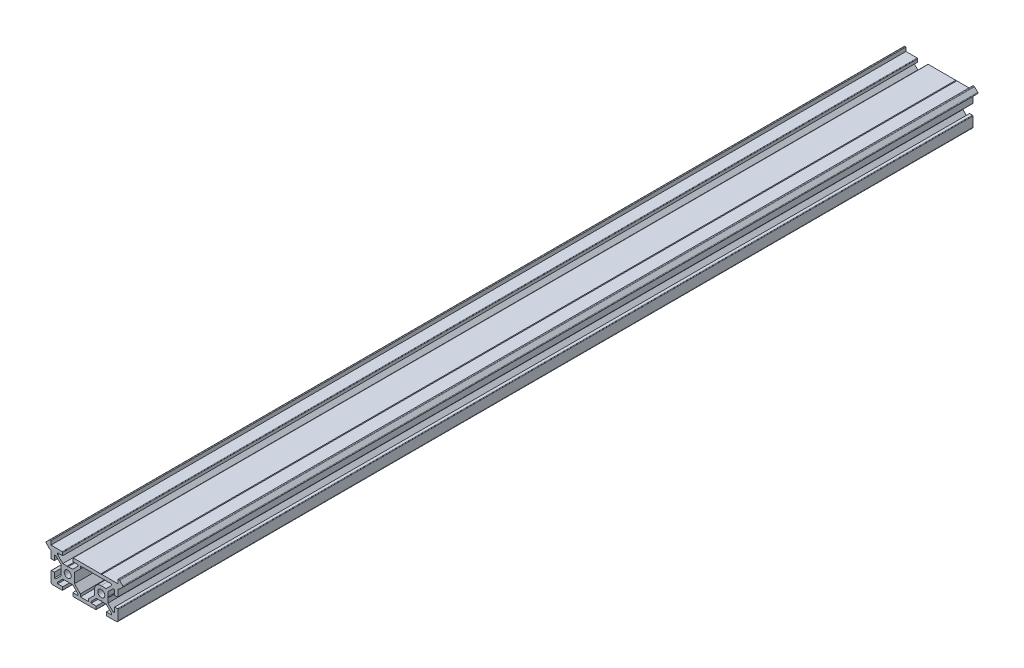
from build123d import *

# Parameters (mm, degrees)
MODEL_R             = 2.100000001
BOSS_EXTRUDE1_DEPTH = 510


with BuildPart() as part:
    # Model → Boss-Extrude1 (new body)
    with BuildSketch(Plane.XY):
        with BuildLine():
            Line((28.771485975, 48.105572105), (30.646485975, 49.980572105))
            ThreePointArc((30.646485975, 49.980572105), (30.808697649, 50.08895848), (31.000039365, 50.127018713))
            Line((31.000039365, 50.127018713), (31.592932584, 50.127018713))
            Line((31.592932584, 50.127018713), (31.592932584, 47.752018713))
            Line((31.592932584, 47.752018713), (38.292932585, 47.752018713))
            ThreePointArc((38.292932585, 47.752018713), (38.505064619, 47.664150748), (38.592932584, 47.452018714))
            Line((38.592932584, 47.452018714), (38.592932584, 45.752018713))
            Line((38.592932584, 45.752018713), (35.592932585, 45.752018713))
            Line((35.592932585, 45.752018713), (35.592932585, 44.812678885))
            Line((35.592932585, 44.812678885), (38.653592756, 41.752018713))
            Line((38.653592756, 41.752018713), (41.292932583, 41.752018713))
            Line((41.292932583, 41.752018713), (41.592932584, 41.452018713))
            Line((41.592932584, 41.452018713), (41.892932586, 41.752018714))
            Line((41.892932586, 41.752018714), (44.532272412, 41.752018714))
            Line((44.532272412, 41.752018714), (47.592932584, 44.812678886))
            Line((47.592932584, 44.812678886), (47.592932584, 45.752018714))
            Line((47.592932584, 45.752018714), (44.592932584, 45.752018714))
            Line((44.592932584, 45.752018714), (44.592932584, 47.452018715))
            ThreePointArc((44.592932584, 47.452018715), (44.68080055, 47.664150749), (44.892932584, 47.752018715))
            Line((44.892932584, 47.752018715), (61.292932583, 47.752018715))
            Line((61.292932583, 47.752018715), (61.592932582, 47.452018715))
            Line((61.592932582, 47.452018715), (61.892932583, 47.752018716))
            Line((61.892932583, 47.752018716), (71.592932583, 47.752018716))
            Line((71.592932583, 47.752018716), (71.592932583, 50.127018711))
            Line((71.592932583, 50.127018711), (72.185825802, 50.127018711))
            ThreePointArc((72.185825802, 50.127018711), (72.377167518, 50.088958477), (72.539379192, 49.980572102))
            Line((72.539379192, 49.980572102), (74.414379192, 48.105572102))
            ThreePointArc((74.414379192, 48.105572102), (74.560825801, 47.752018712), (74.414379192, 47.398465322))
            Line((74.414379192, 47.398465322), (72.539379192, 45.523465322))
            ThreePointArc((72.539379192, 45.523465322), (72.377167518, 45.415078947), (72.185825802, 45.377018714))
            Line((72.185825802, 45.377018714), (72.092932582, 45.377018714))
            ThreePointArc((72.092932582, 45.377018714), (71.739379192, 45.230572103), (71.592932583, 44.877018713))
            Line((71.592932583, 44.877018713), (71.592932583, 41.052018712))
            ThreePointArc((71.592932583, 41.052018712), (71.505064617, 40.839886678), (71.292932581, 40.752018713))
            Line((71.292932581, 40.752018713), (69.592932583, 40.752018713))
            Line((69.592932583, 40.752018713), (69.592932583, 43.752018712))
            Line((69.592932583, 43.752018712), (68.653592755, 43.752018712))
            Line((68.653592755, 43.752018712), (65.592932583, 40.691358541))
            Line((65.592932583, 40.691358541), (65.592932583, 38.052018712))
            Line((65.592932583, 38.052018712), (65.292932584, 37.752018712))
            Line((65.292932584, 37.752018712), (65.592932583, 37.452018713))
            Line((65.592932583, 37.452018713), (65.592932583, 34.812678884))
            Line((65.592932583, 34.812678884), (68.653592755, 31.752018712))
            Line((68.653592755, 31.752018712), (69.592932583, 31.752018712))
            Line((69.592932583, 31.752018712), (69.592932583, 34.752018711))
            Line((69.592932583, 34.752018711), (71.292932581, 34.752018711))
            ThreePointArc((71.292932581, 34.752018711), (71.505064617, 34.664150747), (71.592932583, 34.452018712))
            Line((71.592932583, 34.452018712), (71.592932583, 28.75201871))
            ThreePointArc((71.592932583, 28.75201871), (71.300039364, 28.044911929), (70.592932582, 27.752018711))
            Line((70.592932582, 27.752018711), (64.892932582, 27.752018711))
            ThreePointArc((64.892932582, 27.752018711), (64.680800548, 27.839886676), (64.592932583, 28.05201871))
            Line((64.592932583, 28.05201871), (64.592932583, 29.752018711))
            Line((64.592932583, 29.752018711), (67.592932582, 29.752018711))
            Line((67.592932582, 29.752018711), (67.592932582, 30.69135854))
            Line((67.592932582, 30.69135854), (64.532272411, 33.752018711))
            Line((64.532272411, 33.752018711), (61.892932584, 33.752018711))
            Line((61.892932584, 33.752018711), (61.592932582, 34.052018713))
            Line((61.592932582, 34.052018713), (61.292932582, 33.752018712))
            Line((61.292932582, 33.752018712), (58.653592755, 33.752018712))
            Line((58.653592755, 33.752018712), (55.592932583, 30.691358541))
            Line((55.592932583, 30.691358541), (55.592932583, 29.752018713))
            Line((55.592932583, 29.752018713), (58.592932583, 29.752018713))
            Line((58.592932583, 29.752018713), (58.592932583, 28.052018712))
            ThreePointArc((58.592932583, 28.052018712), (58.505064617, 27.839886678), (58.292932583, 27.752018712))
            Line((58.292932583, 27.752018712), (44.892932584, 27.752018712))
            ThreePointArc((44.892932584, 27.752018712), (44.68080055, 27.839886678), (44.592932584, 28.052018712))
            Line((44.592932584, 28.052018712), (44.592932584, 29.752018713))
            Line((44.592932584, 29.752018713), (47.592932584, 29.752018713))
            Line((47.592932584, 29.752018713), (47.592932584, 30.691358541))
            Line((47.592932584, 30.691358541), (44.532272412, 33.752018712))
            Line((44.532272412, 33.752018712), (41.892932586, 33.752018712))
            Line((41.892932586, 33.752018712), (41.592932584, 34.052018714))
            Line((41.592932584, 34.052018714), (41.292932583, 33.752018714))
            Line((41.292932583, 33.752018714), (38.653592756, 33.752018714))
            Line((38.653592756, 33.752018714), (35.592932585, 30.691358542))
            Line((35.592932585, 30.691358542), (35.592932585, 29.752018714))
            Line((35.592932585, 29.752018714), (38.592932584, 29.752018714))
            Line((38.592932584, 29.752018714), (38.592932584, 28.052018713))
            ThreePointArc((38.592932584, 28.052018713), (38.505064619, 27.839886679), (38.292932585, 27.752018714))
            Line((38.292932585, 27.752018714), (32.592932585, 27.752018714))
            ThreePointArc((32.592932585, 27.752018714), (31.885825803, 28.044911931), (31.592932584, 28.752018713))
            Line((31.592932584, 28.752018713), (31.592932584, 34.452018715))
            ThreePointArc((31.592932584, 34.452018715), (31.68080055, 34.664150748), (31.892932583, 34.752018714))
            Line((31.892932583, 34.752018714), (33.592932584, 34.752018714))
            Line((33.592932584, 34.752018714), (33.592932584, 31.752018715))
            Line((33.592932584, 31.752018715), (34.532272412, 31.752018715))
            Line((34.532272412, 31.752018715), (37.592932584, 34.812678886))
            Line((37.592932584, 34.812678886), (37.592932584, 37.452018715))
            Line((37.592932584, 37.452018715), (37.892932583, 37.752018715))
            Line((37.892932583, 37.752018715), (37.592932584, 38.052018714))
            Line((37.592932584, 38.052018714), (37.592932584, 40.691358543))
            Line((37.592932584, 40.691358543), (34.532272412, 43.752018715))
            Line((34.532272412, 43.752018715), (33.592932584, 43.752018715))
            Line((33.592932584, 43.752018715), (33.592932584, 40.752018716))
            Line((33.592932584, 40.752018716), (31.892932586, 40.752018716))
            ThreePointArc((31.892932586, 40.752018716), (31.68080055, 40.83988668), (31.592932584, 41.052018715))
            Line((31.592932584, 41.052018715), (31.592932584, 44.877018715))
            ThreePointArc((31.592932584, 44.877018715), (31.446485975, 45.230572106), (31.092932585, 45.377018716))
            Line((31.092932585, 45.377018716), (31.000039365, 45.377018716))
            ThreePointArc((31.000039365, 45.377018716), (30.808697649, 45.41507895), (30.646485975, 45.523465324))
            Line((30.646485975, 45.523465324), (28.771485975, 47.398465325))
            ThreePointArc((28.771485975, 47.398465325), (28.625039366, 47.752018715), (28.771485975, 48.105572105))
        make_face()
        with Locations((61.592932582, 37.752018715)):
            Circle(MODEL_R, mode=Mode.SUBTRACT)
        with Locations((41.592932582, 37.752018715)):
            Circle(MODEL_R, mode=Mode.SUBTRACT)
        with BuildLine():
            Line((54.092932584, 29.752018715), (49.092932584, 29.752018715))
            Line((49.092932584, 29.752018715), (49.092932584, 31.312678886))
            Line((49.092932584, 31.312678886), (45.592932583, 34.812678886))
            Line((45.592932583, 34.812678886), (45.592932583, 40.691358543))
            Line((45.592932583, 40.691358543), (49.092932584, 44.191358544))
            Line((49.092932584, 44.191358544), (49.092932584, 45.752018714))
            Line((49.092932584, 45.752018714), (67.592932582, 45.752018714))
            Line((67.592932582, 45.752018714), (67.592932582, 44.812678887))
            Line((67.592932582, 44.812678887), (64.532272411, 41.752018716))
            Line((64.532272411, 41.752018716), (61.402932584, 41.752018716))
            ThreePointArc((61.402932584, 41.752018716), (58.708855747, 40.636095552), (57.592932584, 37.942018716))
            Line((57.592932584, 37.942018716), (57.592932584, 34.812678886))
            Line((57.592932584, 34.812678886), (54.092932584, 31.312678886))
            Line((54.092932584, 31.312678886), (54.092932584, 29.752018715))
        make_face(mode=Mode.SUBTRACT)
    extrude(amount=-BOSS_EXTRUDE1_DEPTH)


solid = part.part
